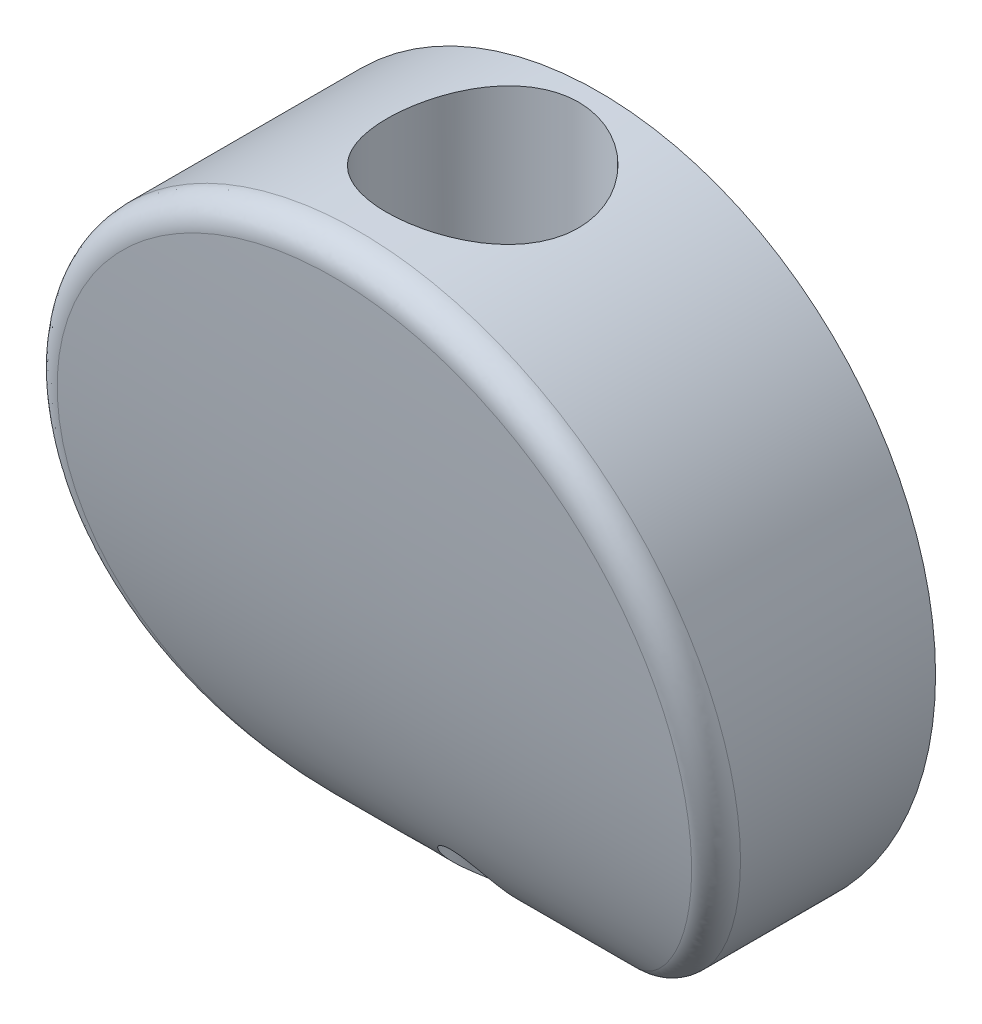
from build123d import *

# Parameters (mm, degrees)
ESQUISSE1_R                         = 67.000000112
BOSS_EXTRU_1_DEPTH                  = 53.34
ENL_V_MAT_EXTRU_1_DEPTH             = 110.092762836
ENL_V_MAT_EXTRU_1_DEPTH_BACK        = 110.092762836
CONG_1_R                            = 5
ENL_V_MAT_EXTRU_2_REACH             = 110.905
ESQUISSE5_R                         = 19.05
ENL_V_MAT_EXTRU_2_DIRECTION_2_DEPTH = 3.81
ESQUISSE6_R                         = 6.35
ENL_V_MAT_EXTRU_3_DEPTH             = 112.299060022


with BuildPart() as part:
    # Esquisse1 → Boss.-Extru.1 (new body)
    with BuildSketch(Plane.XY):
        with Locations((0.290695021, 0.290695021)):
            Circle(ESQUISSE1_R)
    extrude(amount=BOSS_EXTRU_1_DEPTH)

    # Esquisse4 → Enlèv. mat.-Extru.1 (cut, two sides: drawn at the far end of the back side and taken through both)
    with BuildSketch(Plane(origin=(0, 0, 0), x_dir=(0, 0, -1), z_dir=(1, 0, 0)).offset(-ENL_V_MAT_EXTRU_1_DEPTH_BACK)):
        with BuildLine():
            Line((-0.142164152, -67.127156989), (-53.34, -66.709305091))
            Line((-53.34, -66.709305091), (-53.34, 67.290695133))
            add(Edge.make_bspline(
                [(-53.34, 67.290695133), (-53.314901524, 64.965334409), (-44.651911328, -34.890273822), (-23.160447153, -66.373438876), (-0.142164152, -67.127156989)],
                knots=[0, 0, 0, 0, 0.3629696, 1, 1, 1, 1], degree=3))
        make_face()
    extrude(amount=ENL_V_MAT_EXTRU_1_DEPTH + ENL_V_MAT_EXTRU_1_DEPTH_BACK, mode=Mode.SUBTRACT)

    # Congé1
    cong_1_edges = [part.edges().sort_by_distance(p)[0] for p in [
        (-66.598538996, -3.560329145, 44.401259726),
    ]]
    fillet(cong_1_edges, radius=CONG_1_R)

    # Esquisse5 → Enlèv. mat.-Extru.2 (cut, up to next)
    with BuildSketch(Plane(origin=(0, 0, 0), x_dir=(1, 0, 0), z_dir=(0, 1, 0)), mode=Mode.PRIVATE) as enl_v_mat_extru_2_sk1:
        with Locations((0, -22.86)):
            Circle(ESQUISSE5_R)
    enl_v_mat_extru_2_tool1 = extrude(enl_v_mat_extru_2_sk1.sketch, amount=ENL_V_MAT_EXTRU_2_REACH, mode=Mode.PRIVATE) & part.part
    add(enl_v_mat_extru_2_tool1.solids().sort_by_distance((0, 0, 22.86))[0], mode=Mode.SUBTRACT)

    # Esquisse5 → Enlèv. mat.-Extru.2 direction 2 (cut)
    with BuildSketch(Plane(origin=(0, 0, 0), x_dir=(1, 0, 0), z_dir=(0, 1, 0))):
        with Locations((0, -22.86)):
            Circle(ESQUISSE5_R)
    extrude(amount=-ENL_V_MAT_EXTRU_2_DIRECTION_2_DEPTH, mode=Mode.SUBTRACT)

    # Esquisse6 → Enlèv. mat.-Extru.3 (cut, through all)
    with BuildSketch(Plane(origin=(0, -3.81, 0), x_dir=(1, 0, 0), z_dir=(0, 1, 0))):
        with Locations((0, -22.86)):
            Circle(ESQUISSE6_R)
    extrude(amount=-ENL_V_MAT_EXTRU_3_DEPTH, mode=Mode.SUBTRACT)


solid = part.part
